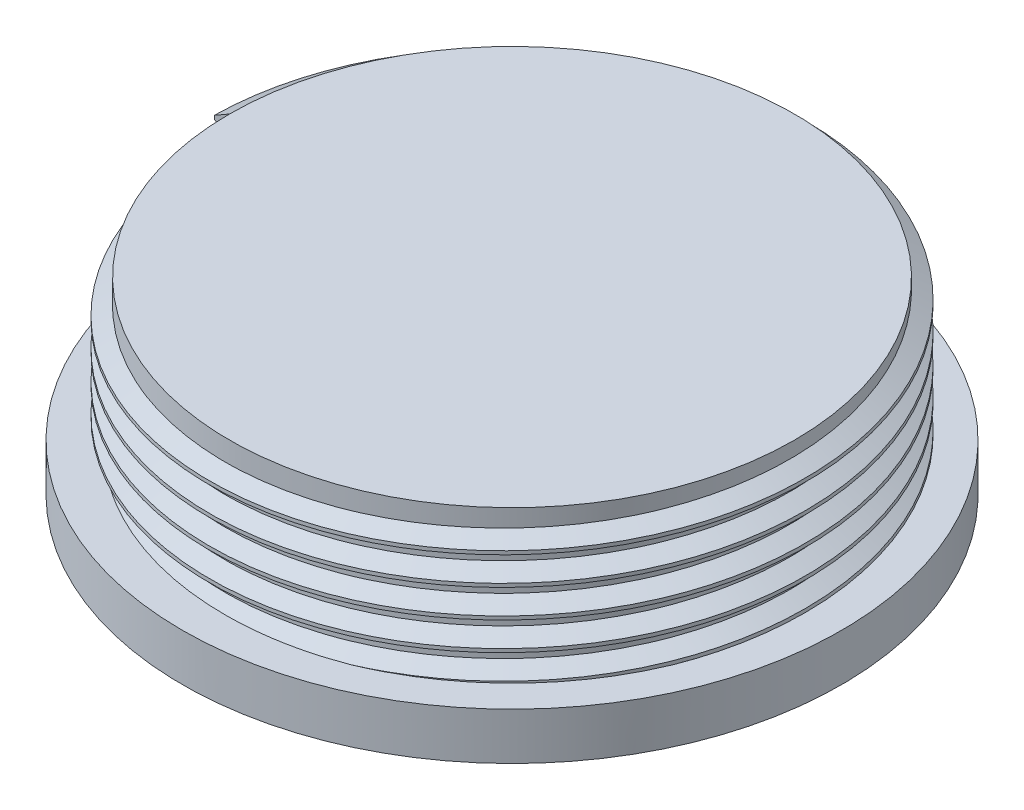
from build123d import *

# Parameters (mm, degrees)
SKETCH1_R           = 50
BOSS_EXTRUDE1_DEPTH = 2.5
SKETCH2_R           = 15
BOSS_EXTRUDE2_DEPTH = 7.5
THREAD1_PITCH       = 1.5
SKETCH3_OUTSIDE_W   = 130.354
SKETCH3_OUTSIDE_H   = 130.354
SKETCH3_OUTSIDE_R   = 17.5
CUT_EXTRUDE1_DEPTH  = 10


with BuildPart() as part:
    # Sketch1 → Boss-Extrude1 (new body)
    with BuildSketch(Plane(origin=(0, 0, 0), x_dir=(1, 0, 0), z_dir=(0, 1, 0))):
        with Locations(Location((0, 0, 0), (0, 0, 270))):
            Circle(SKETCH1_R)
    extrude(amount=BOSS_EXTRUDE1_DEPTH)

    # Sketch2 → Boss-Extrude2 (add)
    with BuildSketch(Plane(origin=(0, 2.5, 0), x_dir=(1, 0, 0), z_dir=(0, 1, 0))):
        with Locations(Location((0, 0, 0), (0, 0, 270))):
            Circle(SKETCH2_R)
    extrude(amount=BOSS_EXTRUDE2_DEPTH)

    # Thread1: the profile of Thread Profile1 profile screwed along a right-hand helix of 5 turns, 8 arcs to a turn; built about Z, then put on its axis
    thread1_z = Axis((0, 0, 0), (0, 0, 1))
    thread1_corners = [(14.9997, 0, -0.000173205), (15.811898813, 0, 0.468749998), (15.811898813, 0, 0.656249998), (14.9997, 0, 1.125173201)]
    with BuildLine(mode=Mode.PRIVATE) as thread1_profile:
        Line(thread1_corners[0], thread1_corners[1])
        Line(thread1_corners[1], thread1_corners[2])
        Line(thread1_corners[2], thread1_corners[3])
        Line(thread1_corners[3], thread1_corners[0])
    thread1_cap = Face(thread1_profile.wire())
    thread1_turn_angles = [0, 22.5, 45, 67.5, 90, 112.5, 135, 157.5, 180, 202.5, 225, 247.5, 270, 292.5, 315, 337.5, 360]
    thread1_turn_weights = [1, 0.9238795325112867, 1, 0.9238795325112867, 1, 0.9238795325112867, 1, 0.9238795325112867, 1, 0.9238795325112867, 1, 0.9238795325112867, 1, 0.9238795325112867, 1, 0.9238795325112867, 1]
    thread1_turn_rails = [Edge.make_bspline([Vector(p[0], p[1], 0).rotate(thread1_z, thread1_turn_angles[k]) / thread1_turn_weights[k] + Vector(0, 0, p[2] + THREAD1_PITCH * thread1_turn_angles[k] / 360) for k in range(17)], [0, 0, 0, 1, 1, 2, 2, 3, 3, 4, 4, 5, 5, 6, 6, 7, 7, 8, 8, 8], 2, thread1_turn_weights) for p in thread1_corners]
    thread1_turn_sides = [Face.make_surface_from_curves(thread1_turn_rails[p[0]], thread1_turn_rails[p[1]]) for p in [(0, 1), (1, 2), (2, 3), (3, 0)]]
    thread1 = Plane(origin=(0, 10, 0), x_dir=(-1, 0, 0), z_dir=(0, -1, 0)) * Solid(Shell([*[p.moved(Location((0, 0, THREAD1_PITCH * i))) for i in range(5) for p in thread1_turn_sides], thread1_cap, thread1_cap.rotate(thread1_z, 1800).moved(Location((0, 0, THREAD1_PITCH * 1800 / 360)))]))
    add(thread1)

    # Sketch3 outside → Cut-Extrude1 (cut)
    with BuildSketch(Plane(origin=(0, 0, 0), x_dir=(-1, 0, 0), z_dir=(0, -1, 0))):
        Rectangle(SKETCH3_OUTSIDE_W, SKETCH3_OUTSIDE_H)
        with Locations(Location((0, 0, 0), (0, 0, 90))):
            Circle(SKETCH3_OUTSIDE_R, mode=Mode.SUBTRACT)
    extrude(amount=-CUT_EXTRUDE1_DEPTH, mode=Mode.SUBTRACT)


solid = part.part
